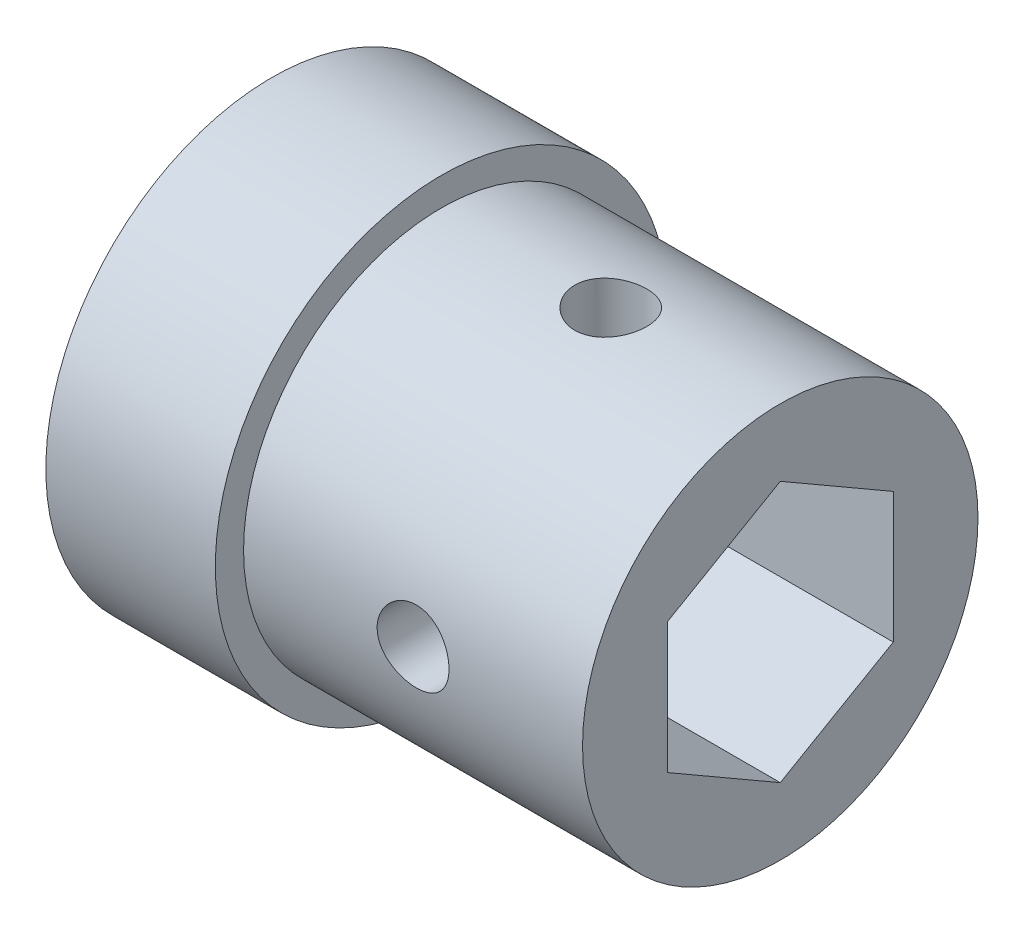
from build123d import *

# Parameters (mm, degrees)
SKETCH1_R               = 11.1125
BOSS_EXTRUDE1_DEPTH     = 19.05
SKETCH2_R               = 12.7
BOSS_EXTRUDE2_DEPTH     = 9.525
CUT_EXTRUDE1_DEPTH      = 34.750712955
CUT_EXTRUDE2_DEPTH      = 27.181720723
CUT_EXTRUDE2_DEPTH_BACK = 27.181720723
SKETCH5_R               = 2.0193
CUT_EXTRUDE3_DEPTH      = 27.181720795
CUT_EXTRUDE3_DEPTH_BACK = 27.181720795
SKETCH6_R               = 2.0193


with BuildPart() as part:
    # Sketch1 → Boss-Extrude1 (new body)
    with BuildSketch(Plane(origin=(0, 0, 0), x_dir=(0, 0, -1), z_dir=(1, 0, 0))):
        Circle(SKETCH1_R)
    extrude(amount=BOSS_EXTRUDE1_DEPTH)

    # Sketch2 → Boss-Extrude2 (add)
    with BuildSketch(Plane.ZY):
        Circle(SKETCH2_R)
    extrude(amount=BOSS_EXTRUDE2_DEPTH)

    # Sketch4 → Cut-Extrude1 (cut, through all)
    with BuildSketch(Plane.ZY.offset(9.525)):
        Polygon((0, 7.332348419), (-6.35, 3.666174209), (-6.35, -3.666174209), (0, -7.332348419), (6.35, -3.666174209), (6.35, 3.666174209), align=None)
    extrude(amount=-CUT_EXTRUDE1_DEPTH, mode=Mode.SUBTRACT)

    # Sketch5 → Cut-Extrude2 (cut, two sides: drawn at the far end of the back side and taken through both)
    with BuildSketch(Plane.XY.offset(-CUT_EXTRUDE2_DEPTH_BACK)):
        with Locations((9.525, 0)):
            Circle(SKETCH5_R)
    extrude(amount=CUT_EXTRUDE2_DEPTH + CUT_EXTRUDE2_DEPTH_BACK, mode=Mode.SUBTRACT)

    # Sketch6 → Cut-Extrude3 (cut, two sides: drawn at the far end of the back side and taken through both)
    with BuildSketch(Plane(origin=(0, 0, 0), x_dir=(1, 0, 0), z_dir=(0, 1, 0)).offset(-CUT_EXTRUDE3_DEPTH_BACK)):
        with Locations((9.525, 0)):
            Circle(SKETCH6_R)
    extrude(amount=CUT_EXTRUDE3_DEPTH + CUT_EXTRUDE3_DEPTH_BACK, mode=Mode.SUBTRACT)


solid = part.part
